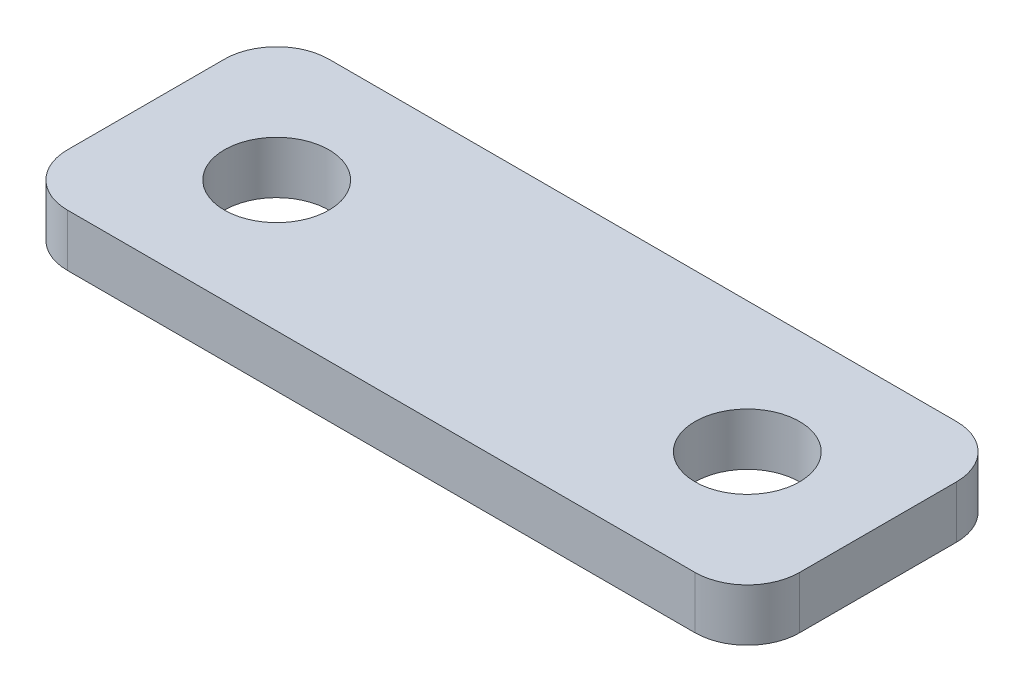
from build123d import *

# Parameters (mm, degrees)
SKETCH1_R           = 3.175
BOSS_EXTRUDE1_DEPTH = 3.175


with BuildPart() as part:
    # Sketch1 → Boss-Extrude1 (new body)
    with BuildSketch(Plane(origin=(0, 0, 0), x_dir=(1, 0, 0), z_dir=(0, 1, 0))):
        with BuildLine():
            Line((-19.05, 7.9375), (19.05, 7.9375))
            ThreePointArc((19.05, 7.9375), (21.29506403, 7.00756403), (22.225, 4.7625))
            Line((22.225, 4.7625), (22.225, -4.7625))
            ThreePointArc((22.225, -4.7625), (21.29506403, -7.00756403), (19.05, -7.9375))
            Line((19.05, -7.9375), (-19.05, -7.9375))
            ThreePointArc((-19.05, -7.9375), (-21.29506403, -7.00756403), (-22.225, -4.7625))
            Line((-22.225, -4.7625), (-22.225, 4.7625))
            ThreePointArc((-22.225, 4.7625), (-21.29506403, 7.00756403), (-19.05, 7.9375))
        make_face()
        with Locations((-14.2875, 0)):
            Circle(SKETCH1_R, mode=Mode.SUBTRACT)
        with Locations((14.2875, 0)):
            Circle(SKETCH1_R, mode=Mode.SUBTRACT)
    extrude(amount=BOSS_EXTRUDE1_DEPTH)


solid = part.part
